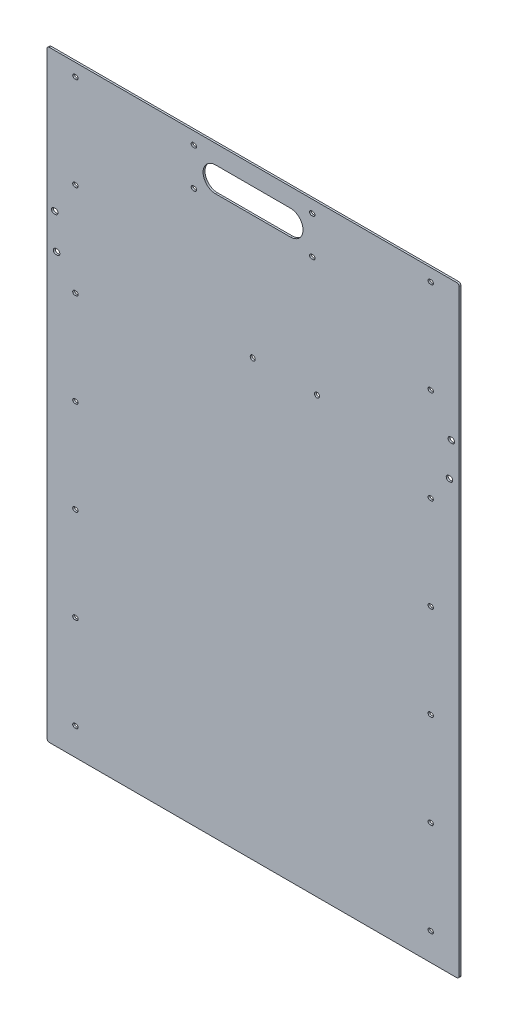
from build123d import *

# Parameters (mm, degrees)
CONVERT_SOLID1_START     = -1.5
CONVERT_SOLID1_OUTLINE_R = 2
CONVERT_SOLID1_DEPTH     = 1.5


# Read off the part's stored shape, not the designer's step: Convert-Solid1
with BuildPart() as part:
    # Convert-Solid1 outline → Convert-Solid1 (new body)
    with BuildSketch(Plane.XY.offset(CONVERT_SOLID1_START)):
        with BuildLine():
            Line((330, 2), (330, 480))
            ThreePointArc((330, 480), (329.414213562, 481.414213562), (328, 482))
            Line((328, 482), (2, 482))
            ThreePointArc((2, 482), (0.585786438, 481.414213562), (0, 480))
            Line((0, 480), (0, 2))
            ThreePointArc((0, 2), (0.585786438, 0.585786438), (2, 0))
            Line((2, 0), (328, 0))
            ThreePointArc((328, 0), (329.414213562, 0.585786438), (330, 2))
        make_face()
        with BuildLine():
            ThreePointArc((23.25, 23.65), (24.9, 22), (23.25, 20.35))
            Line((23.25, 20.35), (22.25, 20.35))
            ThreePointArc((22.25, 20.35), (20.6, 22), (22.25, 23.65))
            Line((22.25, 23.65), (23.25, 23.65))
        make_face(mode=Mode.SUBTRACT)
        with BuildLine():
            ThreePointArc((23.25, 98.65), (24.9, 97), (23.25, 95.35))
            Line((23.25, 95.35), (22.25, 95.35))
            ThreePointArc((22.25, 95.35), (20.6, 97), (22.25, 98.65))
            Line((22.25, 98.65), (23.25, 98.65))
        make_face(mode=Mode.SUBTRACT)
        with BuildLine():
            ThreePointArc((23.25, 173.65), (24.9, 172), (23.25, 170.35))
            Line((23.25, 170.35), (22.25, 170.35))
            ThreePointArc((22.25, 170.35), (20.6, 172), (22.25, 173.65))
            Line((22.25, 173.65), (23.25, 173.65))
        make_face(mode=Mode.SUBTRACT)
        with BuildLine():
            ThreePointArc((307.75, 23.65), (309.4, 22), (307.75, 20.35))
            Line((307.75, 20.35), (306.75, 20.35))
            ThreePointArc((306.75, 20.35), (305.1, 22), (306.75, 23.65))
            Line((306.75, 23.65), (307.75, 23.65))
        make_face(mode=Mode.SUBTRACT)
        with BuildLine():
            ThreePointArc((307.75, 98.65), (309.4, 97), (307.75, 95.35))
            Line((307.75, 95.35), (306.75, 95.35))
            ThreePointArc((306.75, 95.35), (305.1, 97), (306.75, 98.65))
            Line((306.75, 98.65), (307.75, 98.65))
        make_face(mode=Mode.SUBTRACT)
        with BuildLine():
            ThreePointArc((307.75, 173.65), (309.4, 172), (307.75, 170.35))
            Line((307.75, 170.35), (306.75, 170.35))
            ThreePointArc((306.75, 170.35), (305.1, 172), (306.75, 173.65))
            Line((306.75, 173.65), (307.75, 173.65))
        make_face(mode=Mode.SUBTRACT)
        with BuildLine():
            ThreePointArc((23.25, 248.65), (24.9, 247), (23.25, 245.35))
            Line((23.25, 245.35), (22.25, 245.35))
            ThreePointArc((22.25, 245.35), (20.6, 247), (22.25, 248.65))
            Line((22.25, 248.65), (23.25, 248.65))
        make_face(mode=Mode.SUBTRACT)
        with BuildLine():
            ThreePointArc((23.25, 323.65), (24.9, 322), (23.25, 320.35))
            Line((23.25, 320.35), (22.25, 320.35))
            ThreePointArc((22.25, 320.35), (20.6, 322), (22.25, 323.65))
            Line((22.25, 323.65), (23.25, 323.65))
        make_face(mode=Mode.SUBTRACT)
        with BuildLine():
            ThreePointArc((8.23683607, 345.178083895), (10.33683607, 343.078083895), (8.23683607, 340.978083895))
            Line((8.23683607, 340.978083895), (7.23683607, 340.978083895))
            ThreePointArc((7.23683607, 340.978083895), (5.13683607, 343.078083895), (7.23683607, 345.178083895))
            Line((7.23683607, 345.178083895), (8.23683607, 345.178083895))
        make_face(mode=Mode.SUBTRACT)
        with Locations((164.73683607, 348.078083895)):
            Circle(CONVERT_SOLID1_OUTLINE_R, mode=Mode.SUBTRACT)
        with BuildLine():
            ThreePointArc((6.73683607, 372.678083895), (8.83683607, 370.578083895), (6.73683607, 368.478083895))
            Line((6.73683607, 368.478083895), (5.73683607, 368.478083895))
            ThreePointArc((5.73683607, 368.478083895), (3.63683607, 370.578083895), (5.73683607, 372.678083895))
            Line((5.73683607, 372.678083895), (6.73683607, 372.678083895))
        make_face(mode=Mode.SUBTRACT)
        with BuildLine():
            ThreePointArc((23.25, 398.65), (24.9, 397), (23.25, 395.35))
            Line((23.25, 395.35), (22.25, 395.35))
            ThreePointArc((22.25, 395.35), (20.6, 397), (22.25, 398.65))
            Line((22.25, 398.65), (23.25, 398.65))
        make_face(mode=Mode.SUBTRACT)
        with BuildLine():
            ThreePointArc((23.25, 473.65), (24.9, 472), (23.25, 470.35))
            Line((23.25, 470.35), (22.25, 470.35))
            ThreePointArc((22.25, 470.35), (20.6, 472), (22.25, 473.65))
            Line((22.25, 473.65), (23.25, 473.65))
        make_face(mode=Mode.SUBTRACT)
        with BuildLine():
            ThreePointArc((118.083333333, 443.65), (119.733333333, 442), (118.083333333, 440.35))
            Line((118.083333333, 440.35), (117.083333333, 440.35))
            ThreePointArc((117.083333333, 440.35), (115.433333333, 442), (117.083333333, 443.65))
            Line((117.083333333, 443.65), (118.083333333, 443.65))
        make_face(mode=Mode.SUBTRACT)
        with BuildLine():
            ThreePointArc((118.083333333, 473.65), (119.733333333, 472), (118.083333333, 470.35))
            Line((118.083333333, 470.35), (117.083333333, 470.35))
            ThreePointArc((117.083333333, 470.35), (115.433333333, 472), (117.083333333, 473.65))
            Line((117.083333333, 473.65), (118.083333333, 473.65))
        make_face(mode=Mode.SUBTRACT)
        with Locations((216.13683607, 348.078083895)):
            Circle(CONVERT_SOLID1_OUTLINE_R, mode=Mode.SUBTRACT)
        with BuildLine():
            ThreePointArc((307.75, 248.65), (309.4, 247), (307.75, 245.35))
            Line((307.75, 245.35), (306.75, 245.35))
            ThreePointArc((306.75, 245.35), (305.1, 247), (306.75, 248.65))
            Line((306.75, 248.65), (307.75, 248.65))
        make_face(mode=Mode.SUBTRACT)
        with BuildLine():
            ThreePointArc((307.75, 323.65), (309.4, 322), (307.75, 320.35))
            Line((307.75, 320.35), (306.75, 320.35))
            ThreePointArc((306.75, 320.35), (305.1, 322), (306.75, 323.65))
            Line((306.75, 323.65), (307.75, 323.65))
        make_face(mode=Mode.SUBTRACT)
        with BuildLine():
            ThreePointArc((322.76316393, 345.178083895), (324.86316393, 343.078083895), (322.76316393, 340.978083895))
            Line((322.76316393, 340.978083895), (321.76316393, 340.978083895))
            ThreePointArc((321.76316393, 340.978083895), (319.66316393, 343.078083895), (321.76316393, 345.178083895))
            Line((321.76316393, 345.178083895), (322.76316393, 345.178083895))
        make_face(mode=Mode.SUBTRACT)
        with BuildLine():
            ThreePointArc((195, 467), (205, 457), (195, 447))
            Line((195, 447), (135, 447))
            ThreePointArc((135, 447), (125, 457), (135, 467))
            Line((135, 467), (195, 467))
        make_face(mode=Mode.SUBTRACT)
        with BuildLine():
            ThreePointArc((212.916666667, 443.65), (214.566666667, 442), (212.916666667, 440.35))
            Line((212.916666667, 440.35), (211.916666667, 440.35))
            ThreePointArc((211.916666667, 440.35), (210.266666667, 442), (211.916666667, 443.65))
            Line((211.916666667, 443.65), (212.916666667, 443.65))
        make_face(mode=Mode.SUBTRACT)
        with BuildLine():
            ThreePointArc((212.916666667, 473.65), (214.566666667, 472), (212.916666667, 470.35))
            Line((212.916666667, 470.35), (211.916666667, 470.35))
            ThreePointArc((211.916666667, 470.35), (210.266666667, 472), (211.916666667, 473.65))
            Line((211.916666667, 473.65), (212.916666667, 473.65))
        make_face(mode=Mode.SUBTRACT)
        with BuildLine():
            ThreePointArc((324.26316393, 372.678083895), (326.36316393, 370.578083895), (324.26316393, 368.478083895))
            Line((324.26316393, 368.478083895), (323.26316393, 368.478083895))
            ThreePointArc((323.26316393, 368.478083895), (321.16316393, 370.578083895), (323.26316393, 372.678083895))
            Line((323.26316393, 372.678083895), (324.26316393, 372.678083895))
        make_face(mode=Mode.SUBTRACT)
        with BuildLine():
            ThreePointArc((307.75, 398.65), (309.4, 397), (307.75, 395.35))
            Line((307.75, 395.35), (306.75, 395.35))
            ThreePointArc((306.75, 395.35), (305.1, 397), (306.75, 398.65))
            Line((306.75, 398.65), (307.75, 398.65))
        make_face(mode=Mode.SUBTRACT)
        with BuildLine():
            ThreePointArc((307.75, 473.65), (309.4, 472), (307.75, 470.35))
            Line((307.75, 470.35), (306.75, 470.35))
            ThreePointArc((306.75, 470.35), (305.1, 472), (306.75, 473.65))
            Line((306.75, 473.65), (307.75, 473.65))
        make_face(mode=Mode.SUBTRACT)
    extrude(amount=CONVERT_SOLID1_DEPTH)


solid = part.part
